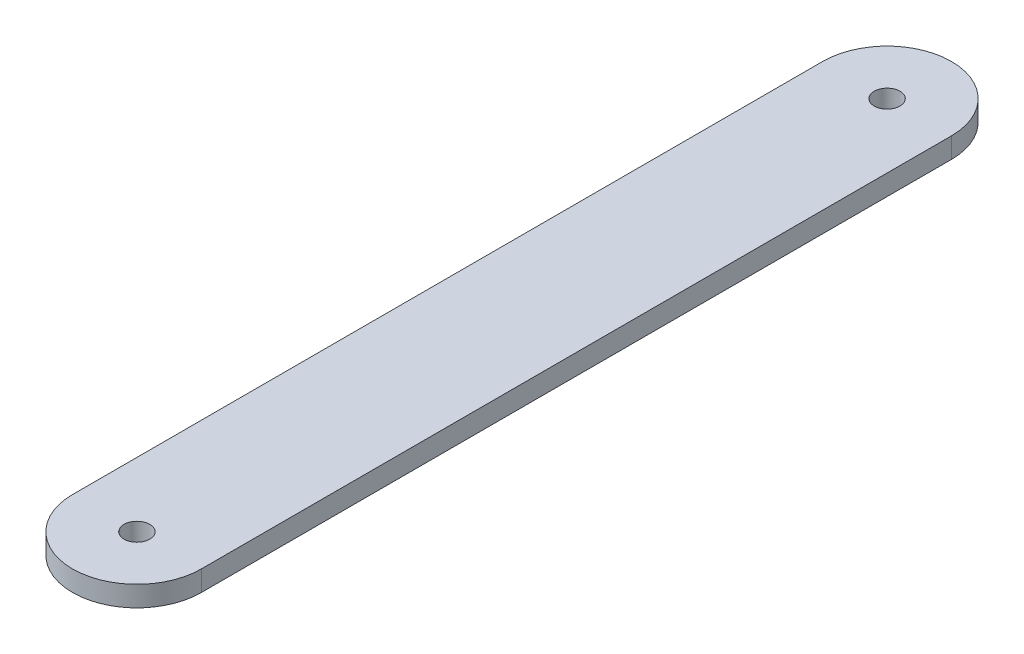
from build123d import *

# Parameters (mm, degrees)
SKETCH2_R           = 1
BOSS_EXTRUDE1_DEPTH = 1.5875


with BuildPart() as part:
    # Sketch2 → Boss-Extrude1 (new body)
    with BuildSketch(Plane(origin=(0, 0, 0), x_dir=(1, 0, 0), z_dir=(0, 1, 0))):
        with BuildLine():
            Line((-5, 58.2405), (-5, 0))
            ThreePointArc((-5, 0), (0, -5), (5, 0))
            Line((5, 0), (5, 58.2405))
            ThreePointArc((5, 58.2405), (0, 63.2405), (-5, 58.2405))
        make_face()
        Circle(SKETCH2_R, mode=Mode.SUBTRACT)
        with Locations((0, 58.2405)):
            Circle(SKETCH2_R, mode=Mode.SUBTRACT)
    extrude(amount=BOSS_EXTRUDE1_DEPTH)


solid = part.part
